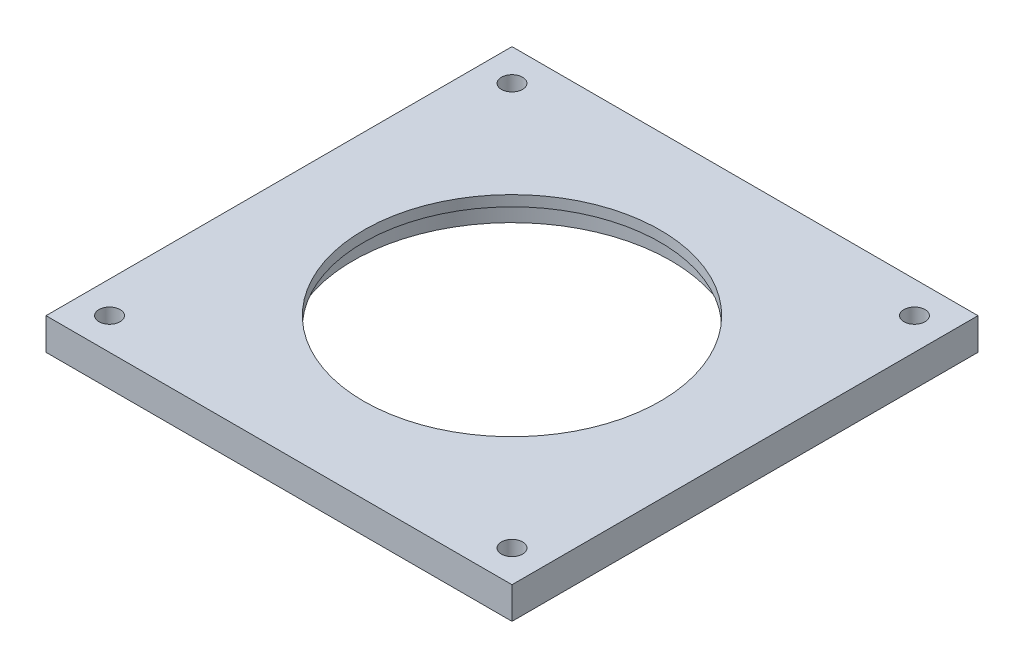
from build123d import *

# Parameters (mm, degrees)
SKETCH1_R           = 1
BOSS_EXTRUDE1_DEPTH = 3
SKETCH3_W           = 1
SKETCH3_H           = 2
MIRROR1_OUTLINE_R   = 1
MIRROR1_DEPTH       = 3
MIRROR1_START       = 2
MIRROR1_2_DEPTH     = 1


# Read off the part's stored shape, not the designer's step: Mirror1
with BuildPart() as part:
    # Sketch1 → Boss-Extrude1 (new body)
    with BuildSketch(Plane(origin=(0, 0, 0), x_dir=(1, 0, 0), z_dir=(0, 1, 0))):
        with BuildLine():
            Line((0, 0), (22, 0))
            Line((22, 0), (22, 8))
            ThreePointArc((22, 8), (12.100505063, 12.100505063), (8, 22))
            Line((8, 22), (0, 22))
            Line((0, 22), (0, 0))
        make_face()
        with Locations(Location((3, 3, 0), (0, 0, 270))):
            Circle(SKETCH1_R, mode=Mode.SUBTRACT)
    extrude(amount=BOSS_EXTRUDE1_DEPTH)

    # Sketch3 → Cut-Revolve1 (revolve, cut)
    with BuildSketch(Plane(origin=(22, 0, 0), x_dir=(0, 0, -1), z_dir=(1, 0, 0))):
        with Locations((7.5, 1)):
            Rectangle(SKETCH3_W, SKETCH3_H)
    revolve(axis=Axis((22, 7.36812707, -22), (0, -1, 0)), mode=Mode.SUBTRACT)

    # Mirror1 outline → Mirror1 (add)
    with BuildSketch(Plane(origin=(0, 0, 0), x_dir=(1, 0, 0), z_dir=(0, 1, 0))):
        with BuildLine():
            Line((0, 44), (0, 22))
            Line((0, 22), (7, 22))
            ThreePointArc((7, 22), (32.606601718, 32.606601718), (22, 7))
            Line((22, 7), (22, 0))
            Line((22, 0), (44, 0))
            Line((44, 0), (44, 44))
            Line((44, 44), (0, 44))
        make_face()
        with Locations((41, 3)):
            Circle(MIRROR1_OUTLINE_R, mode=Mode.SUBTRACT)
        with Locations((3, 41)):
            Circle(MIRROR1_OUTLINE_R, mode=Mode.SUBTRACT)
        with Locations((41, 41)):
            Circle(MIRROR1_OUTLINE_R, mode=Mode.SUBTRACT)
    extrude(amount=MIRROR1_DEPTH)

    # Mirror1 2 outline → Mirror1 2 (add)
    with BuildSketch(Plane(origin=(0, 0, 0), x_dir=(1, 0, 0), z_dir=(0, 1, 0)).offset(MIRROR1_START)):
        with BuildLine():
            ThreePointArc((22, 7), (32.606601718, 32.606601718), (7, 22))
            Line((7, 22), (8, 22))
            ThreePointArc((8, 22), (31.899494937, 31.899494937), (22, 8))
            Line((22, 8), (22, 7))
        make_face()
    extrude(amount=MIRROR1_2_DEPTH)


solid = part.part
